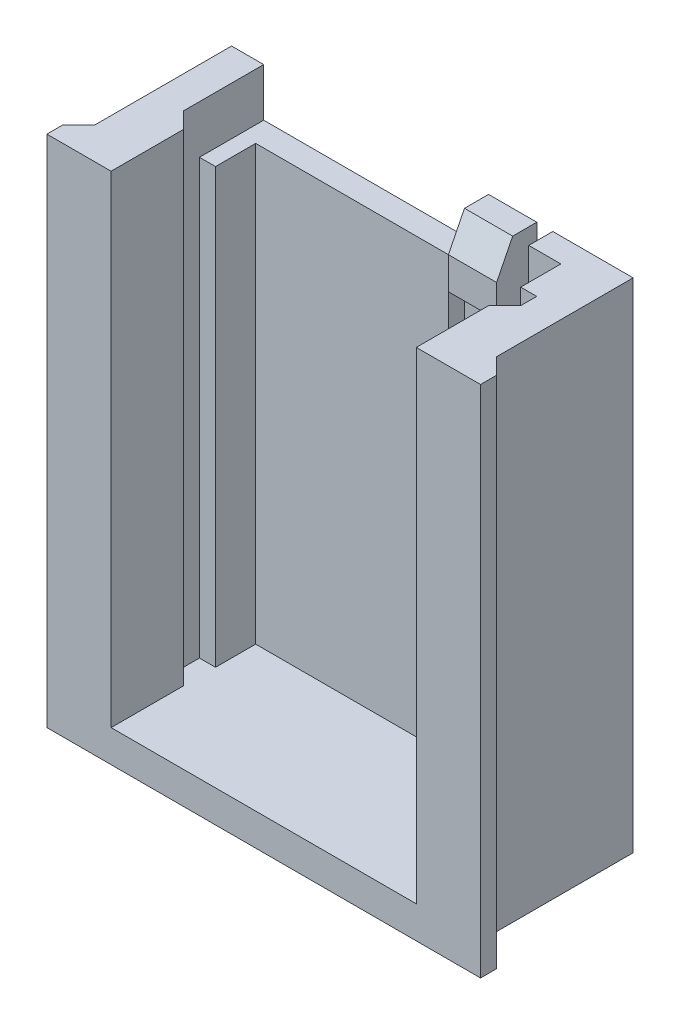
from build123d import *

# Parameters (mm, degrees)
SKETCH1_W               = 25
SKETCH1_H               = 10.5
BOSS_EXTRUDE1_DEPTH     = 31
CUT_EXTRUDE1_DEPTH      = 30
SKETCH8_W               = 3
SKETCH8_H               = 2
BOSS_EXTRUDE4_DEPTH     = 1
CHAMFER1_SIZE2          = 1
CHAMFER1_SIZE           = 2
CUT_EXTRUDE_THIN1_DEPTH = 35.615747861
CUT_EXTRUDE5_REACH      = 37.036
SKETCH10_W              = 13
SKETCH10_H              = 3
EXTRUDE_THIN1_DEPTH     = 1
CHAMFER2_SIZE           = 1
CHAMFER3_SIZE           = 1


with BuildPart() as part:
    # Sketch1 → Boss-Extrude1 (new body)
    with BuildSketch(Plane(origin=(0, 0, 0), x_dir=(1, 0, 0), z_dir=(0, 1, 0))):
        Rectangle(SKETCH1_W, SKETCH1_H)
    extrude(amount=BOSS_EXTRUDE1_DEPTH)

    # Sketch2 → Cut-Extrude1 (cut)
    with BuildSketch(Plane(origin=(0, 31, 0), x_dir=(1, 0, 0), z_dir=(0, 1, 0))):
        Polygon((-9.5, 3.75), (9.5, 3.75), (9.5, 1.25), (10.5, 1.25), (10.5, -0.75), (9.5, -0.75), (9.5, -5.25), (-9.5, -5.25), (-9.5, -0.75), (-10.5, -0.75), (-10.5, 1.25), (-9.5, 1.25), align=None)
    extrude(amount=-CUT_EXTRUDE1_DEPTH, mode=Mode.SUBTRACT)

    # Sketch8 → Boss-Extrude4 (add)
    with BuildSketch(Plane.XY.offset(-3.75)):
        with Locations((5, 28)):
            Rectangle(SKETCH8_W, SKETCH8_H)
    extrude(amount=BOSS_EXTRUDE4_DEPTH)

    # Chamfer1
    chamfer1_edges = [part.edges().sort_by_distance(p)[0] for p in [
        (5, 29, -3.75),
    ]]
    chamfer1_side = [part.faces().sort_by_distance(p)[0] for p in [
        (5, 29.02, -3.75),
    ]]
    chamfer(chamfer1_edges, length=CHAMFER1_SIZE - 0.0001, length2=CHAMFER1_SIZE2 - 0.0001, reference=chamfer1_side[0])  # a hair under: the kernel refuses the full size

    # Sketch9 → Cut-Extrude-Thin1 (cut, through all)
    with BuildSketch(Plane.XY.offset(-3.75)):
        Polygon((6.5, 18), (6.5, 31), (3.5, 31), (3.5, 18), (2.5, 18), (2.5, 32), (7.5, 32), (7.5, 18), align=None)
    extrude(amount=-CUT_EXTRUDE_THIN1_DEPTH, mode=Mode.SUBTRACT)

    # Sketch10 → Cut-Extrude5 (cut, up to next)
    with BuildSketch(Plane(origin=(0, 0, -5.25), x_dir=(-1, 0, 0), z_dir=(0, 0, -1)), mode=Mode.PRIVATE) as cut_extrude5_sk1:
        with Locations((4, 29.5)):
            Rectangle(SKETCH10_W, SKETCH10_H)
    cut_extrude5_tool1 = extrude(cut_extrude5_sk1.sketch, amount=-CUT_EXTRUDE5_REACH, mode=Mode.PRIVATE) & part.part
    add(cut_extrude5_tool1.solids().sort_by_distance((-4, 29.5, -5.25))[0], mode=Mode.SUBTRACT)

    # Sketch11 → Extrude-Thin1 (add)
    with BuildSketch(Plane.XY.offset(5.25)):
        Polygon((12.5, 31), (12.5, 0), (-12.5, 0), (-12.5, 31), (-13.5, 31), (-13.5, -1), (13.5, -1), (13.5, 31), align=None)
    extrude(amount=-EXTRUDE_THIN1_DEPTH)

    # Chamfer2
    chamfer2_edges = [part.edges().sort_by_distance(p)[0] for p in [
        (-12.5, 15.5, 4.25),
        (0, 0, 4.25),
        (12.5, 15.5, 4.25),
    ]]
    chamfer(chamfer2_edges, length=CHAMFER2_SIZE - 0.0001)  # a hair under: the kernel refuses the full size

    # Chamfer3
    chamfer3_edges = [part.edges().sort_by_distance(p)[0] for p in [
        (-10.5, 16, 0.75),
        (10.5, 16, 0.75),
    ]]
    chamfer(chamfer3_edges, length=CHAMFER3_SIZE - 0.0001)  # a hair under: the kernel refuses the full size


solid = part.part
